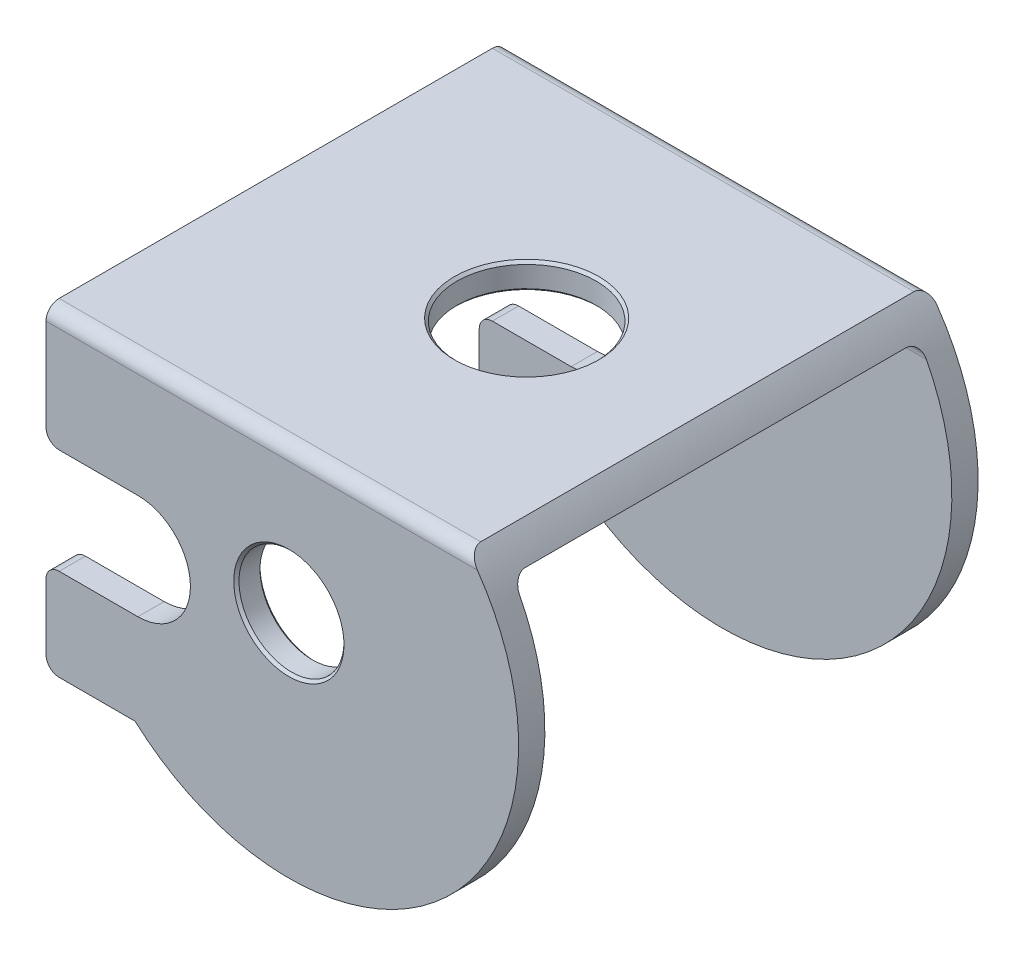
from build123d import *

# Parameters (mm, degrees)
GEARB_W_DEPTH       = 17.5
SKETCH_2_R          = 4
CUT_EXTRUDE_1_DEPTH = 44.283946216
GEARB_T_W           = 31
GEARB_T_H           = 26.5
CUT_EXTRUDE_2_DEPTH = 44.686382318
CUT_EXTRUDE_3_REACH = 40.22
SKETCH_4_R          = 5.3
FILLET_1_R          = 1
FILLET_2_R          = 1
CHAMFER_1_SIZE      = 0.2


with BuildPart() as part:
    # ｽｹｯﾁ1 → GearB-W (new, symmetric)
    with BuildSketch(Plane.XY):
        with BuildLine():
            Line((-18.5, 11), (-18.5, -13))
            Line((-18.5, -13), (-11.715374514, -13))
            ThreePointArc((-11.715374514, -13), (12.037359531, -12.702439747), (13.610657589, 11))
            Line((13.610657589, 11), (-18.5, 11))
        make_face()
    extrude(amount=GEARB_W_DEPTH, both=True)

    # ｽｹｯﾁ2 → ｶｯﾄ - 押し出し1 (cut, through all)
    with BuildSketch(Plane.XY.offset(17.5)):
        Circle(SKETCH_2_R)
        with BuildLine():
            Line((-18.5, 2), (-11.5, 2))
            ThreePointArc((-11.5, 2), (-7.5, -2), (-11.5, -6))
            Line((-11.5, -6), (-18.5, -6))
            Line((-18.5, -6), (-18.5, 2))
        make_face()
    extrude(amount=-CUT_EXTRUDE_1_DEPTH, mode=Mode.SUBTRACT)

    # GearB-t → ｶｯﾄ - 押し出し2 (cut, through all)
    with BuildSketch(Plane.ZY.offset(18.5)):
        with Locations((0, -4.25)):
            Rectangle(GEARB_T_W, GEARB_T_H)
    extrude(amount=-CUT_EXTRUDE_2_DEPTH, mode=Mode.SUBTRACT)

    # ｽｹｯﾁ4 → ｶｯﾄ - 押し出し3 (cut, up to next)
    with BuildSketch(Plane(origin=(0, 11, 0), x_dir=(1, 0, 0), z_dir=(0, 1, 0)), mode=Mode.PRIVATE) as cut_extrude_3_sk1:
        with Locations((0.610657589, 0)):
            Circle(SKETCH_4_R)
    cut_extrude_3_tool1 = extrude(cut_extrude_3_sk1.sketch, amount=-CUT_EXTRUDE_3_REACH, mode=Mode.PRIVATE) & part.part
    add(cut_extrude_3_tool1.solids().sort_by_distance((0.610658, 11, 0))[0], mode=Mode.SUBTRACT)

    # ﾌｨﾚｯﾄ1
    fillet_1_edges = [part.edges().sort_by_distance(p)[0] for p in [
        (-18.5, -13, -16.5),
        (-18.5, -13, 16.5),
        (-18.5, -6, -16.5),
        (-18.5, -6, 16.5),
        (-18.5, 2, -16.5),
        (-18.5, 2, 16.5),
    ]]
    fillet(fillet_1_edges, radius=FILLET_1_R)

    # ﾌｨﾚｯﾄ2
    fillet_2_edges = [part.edges().sort_by_distance(p)[0] for p in [
        (-2.444671206, 11, -17.5),
        (-2.444671206, 11, 17.5),
        (-1.74583449, 9, -15.5),
        (-1.74583449, 9, 15.5),
    ]]
    fillet(fillet_2_edges, radius=FILLET_2_R)

    # 面取り1
    chamfer_1_edges = [part.edges().sort_by_distance(p)[0] for p in [
        (-4, 0, 15.5),
        (-4, 0, 17.5),
        (-4, 0, -15.5),
        (-4, 0, -17.5),
        (-4.689342411, 9, 0),
        (-4.689342411, 11, 0),
    ]]
    chamfer(chamfer_1_edges, length=CHAMFER_1_SIZE)


solid = part.part
